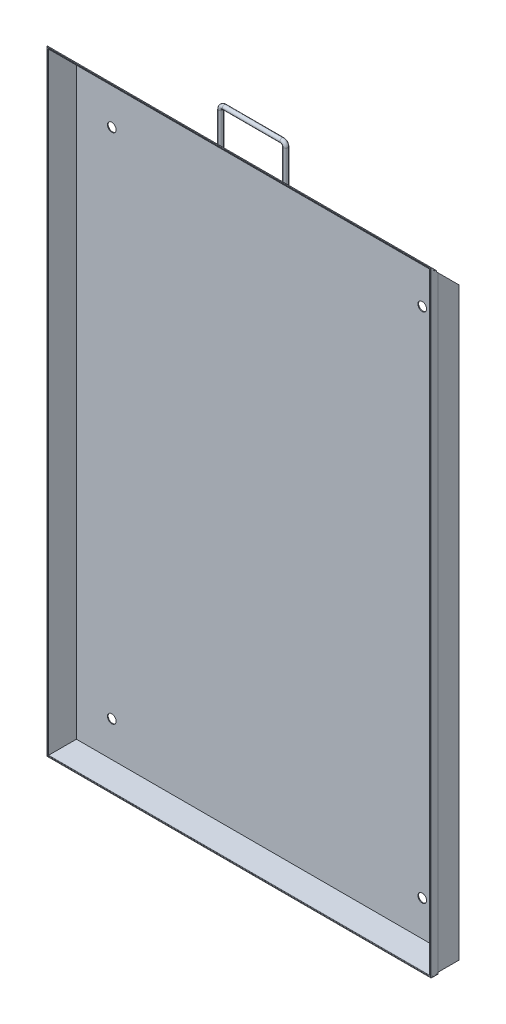
from build123d import *
from build123d.topology import SkipClean

# Parameters (mm, degrees)
BOSS_EXTRUDE1_DEPTH  = 265
BOSS_EXTRUDE2_DEPTH  = 1
BOSS_EXTRUDE3_DEPTH  = 1
SKETCH5_R            = 6
CUT_EXTRUDE1_DEPTH   = 1
BOSS_EXTRUDE5_REACH  = 913.299
SKETCH6_R            = 3
SKETCH10_R           = 3
BOSS_EXTRUDE7_DEPTH  = 1
BOSS_EXTRUDE8_DEPTH  = 1
SKETCH16_W           = 532.2
SKETCH16_H           = 10
BOSS_EXTRUDE9_DEPTH  = 1
SKETCH18_W           = 532.2
SKETCH18_H           = 10
BOSS_EXTRUDE10_DEPTH = 1
SKETCH19_W           = 532.2
SKETCH19_H           = 851.170710678
SKETCH19_W_2         = 528
SKETCH19_H_2         = 847.585786438
BOSS_EXTRUDE11_DEPTH = 1
CUT_EXTRUDE2_DEPTH   = 532.2
FILLET1_R            = 0.5
FILLET2_START        = -267
FILLET2_DEPTH        = 534


with BuildPart() as part:
    # Sketch2 → Boss-Extrude1 (new, symmetric)
    with BuildSketch(Plane(origin=(0, 0, 0), x_dir=(0, 0, -1), z_dir=(1, 0, 0))):
        Polygon((0, 20), (-40, 20), (-40, 21), (-1, 21), (-1, 829.585786438), (-40, 868.585786438), (-40, 870), (0, 830), align=None)
    extrude(amount=BOSS_EXTRUDE1_DEPTH, both=True)

    # Sketch3 → Boss-Extrude2 (add)
    with BuildSketch(Plane(origin=(265, 0, 0), x_dir=(0, 0, -1), z_dir=(1, 0, 0))):
        Polygon((-40, 870), (0, 830), (0, 20), (-40, 20), align=None)
    extrude(amount=-BOSS_EXTRUDE2_DEPTH)

    # Sketch4 → Boss-Extrude3 (add)
    with BuildSketch(Plane.ZY.offset(265)):
        Polygon((40, 870), (0, 830), (0, 20), (40, 20), align=None)
    extrude(amount=-BOSS_EXTRUDE3_DEPTH)

    # Sketch5 → Cut-Extrude1 (cut)
    with BuildSketch(Plane.XY.offset(1)):
        with Locations((215, 779.585786438)):
            Circle(SKETCH5_R)
        with Locations((215, 70)):
            Circle(SKETCH5_R)
        with Locations((-215, 779.585786438)):
            Circle(SKETCH5_R)
        with Locations((-215, 70)):
            Circle(SKETCH5_R)
    extrude(amount=-CUT_EXTRUDE1_DEPTH, mode=Mode.SUBTRACT)

    # Boss-Extrude5: up to this plane
    boss_extrude5_end = Plane(origin=(265, 870, 40), z_dir=(0, -0.7071067811865444, 0.7071067811865508))
    # Sketch6 → Boss-Extrude5 (add, up to the surface)
    with BuildSketch(Plane(origin=(0, 891, 0), x_dir=(1, 0, 0), z_dir=(0, 1, 0)), mode=Mode.PRIVATE) as boss_extrude5_sk1:
        with Locations(Location((-45, -20, 0), (0, 0, 270))):
            Circle(SKETCH6_R)
    boss_extrude5_tool1 = split(extrude(boss_extrude5_sk1.sketch, amount=-BOSS_EXTRUDE5_REACH, mode=Mode.PRIVATE), bisect_by=boss_extrude5_end, keep=Keep.BOTH, mode=Mode.PRIVATE)
    add(boss_extrude5_tool1.solids().sort_by_distance((-45, 891, 20))[0])
    # Sketch6 → Boss-Extrude5 (add, up to the surface)
    with BuildSketch(Plane(origin=(0, 891, 0), x_dir=(1, 0, 0), z_dir=(0, 1, 0)), mode=Mode.PRIVATE) as boss_extrude5_sk2:
        with Locations(Location((45, -20, 0), (0, 0, 270))):
            Circle(SKETCH6_R)
    boss_extrude5_tool2 = split(extrude(boss_extrude5_sk2.sketch, amount=-BOSS_EXTRUDE5_REACH, mode=Mode.PRIVATE), bisect_by=boss_extrude5_end, keep=Keep.BOTH, mode=Mode.PRIVATE)
    add(boss_extrude5_tool2.solids().sort_by_distance((45, 891, 20))[0])

    # Sweep1: sweep along a path in Sketch9
    with SkipClean():  # the faces are left unmerged after this step: merging them gives an invalid solid
        with BuildLine(Plane(origin=(0, 0, 20), x_dir=(-1, 0, 0), z_dir=(0, 0, -1))) as sweep1_path:
            Line((-45, 891), (-45, 896))
            ThreePointArc((-45, 896), (-43.535533906, 899.535533906), (-40, 901))
            Line((-40, 901), (40, 901))
            ThreePointArc((40, 901), (43.535533906, 899.535533906), (45, 896))
            Line((45, 896), (45, 891))
        # Sketch10 → Sweep1 (sweep)
        with BuildSketch(Plane(origin=(0, 891, 0), x_dir=(1, 0, 0), z_dir=(0, 1, 0))):
            with Locations((45, -20)):
                Circle(SKETCH10_R)
        sweep(path=sweep1_path.line)



with BuildPart() as body_2:
    # Sketch13 → Boss-Extrude7 (new body)
    with BuildSketch(Plane(origin=(265.1, 0, 0), x_dir=(0, 0, -1), z_dir=(1, 0, 0))):
        Polygon((-30, 20), (-30, 860), (-40, 870), (-40, 20), align=None)
    extrude(amount=BOSS_EXTRUDE7_DEPTH)


with BuildPart() as body_3:
    # Sketch15 → Boss-Extrude8 (new body)
    with BuildSketch(Plane.ZY.offset(265.1)):
        Polygon((30, 20), (30, 860), (40, 870), (40, 20), align=None)
    extrude(amount=BOSS_EXTRUDE8_DEPTH)


with BuildPart() as body_4:
    # Sketch16 → Boss-Extrude9 (new body)
    with BuildSketch(Plane(origin=(0, 19.9, 0), x_dir=(-1, 0, 0), z_dir=(0, -1, 0))):
        with Locations((0, -35)):
            Rectangle(SKETCH16_W, SKETCH16_H)
    extrude(amount=BOSS_EXTRUDE9_DEPTH)


with BuildPart() as body_5:
    # Sketch18 → Boss-Extrude10 (new body)
    with BuildSketch(Plane(origin=(0, 415.070710678, -415.070710678), x_dir=(-1, 0, 0), z_dir=(0, 0.7071067811865445, -0.7071067811865507))):
        with Locations((0, 638.46717088)):
            Rectangle(SKETCH18_W, SKETCH18_H)
    extrude(amount=BOSS_EXTRUDE10_DEPTH)


with BuildPart() as part_1:
    with SkipClean():  # the faces are left unmerged after this step: merging them gives an invalid solid
        add(part.part)

        add(body_2.part)  # Boss-Extrude11 merges body 2

        add(body_3.part)  # Boss-Extrude11 merges body 3

        add(body_4.part)  # Boss-Extrude11 merges body 4

        add(body_5.part)  # Boss-Extrude11 merges body 5
        # Sketch19 → Boss-Extrude11 (add)
        with BuildSketch(Plane.XY.offset(40)):
            with Locations((0, 444.485355339)):
                Rectangle(SKETCH19_W, SKETCH19_H)
            with Locations((0, 444.792893219)):
                Rectangle(SKETCH19_W_2, SKETCH19_H_2, mode=Mode.SUBTRACT)
        extrude(amount=-BOSS_EXTRUDE11_DEPTH)

    # Sketch20 → Cut-Extrude2 (cut)
    with SkipClean():  # the faces are left unmerged after this step: merging them gives an invalid solid
        with BuildSketch(Plane(origin=(266.1, 0, 0), x_dir=(0, 0, -1), z_dir=(1, 0, 0))):
            Polygon((-39.929289322, 870.070710678), (-40, 870), (-40, 870.070710678), align=None)
        extrude(amount=-CUT_EXTRUDE2_DEPTH, mode=Mode.SUBTRACT)

    # Fillet1
    # the kernel refuses this fillet: 0.5 mm, written as the material it takes off along each edge
    with BuildSketch(Plane(origin=(267.35, 18.9, 40), x_dir=(0, 1, 0), z_dir=(-1, 0, 0))) as fillet1_piece_1:
        with BuildLine():
            CenterArc((FILLET1_R, FILLET1_R), FILLET1_R, 180, 90)
            Line((0, FILLET1_R), (0, 0))
            Line((0, 0), (FILLET1_R, 0))
        make_face()
    extrude(amount=534.7, mode=Mode.SUBTRACT)
    with BuildSketch(Plane(origin=(266.1, 871.25, 40), x_dir=(0, 0, -1), z_dir=(0, -1, 0))) as fillet1_piece_2:
        with BuildLine():
            CenterArc((FILLET1_R, -FILLET1_R), FILLET1_R, 90, 90)
            Line((0, -FILLET1_R), (0, 0))
            Line((0, 0), (FILLET1_R, 0))
        make_face()
    extrude(amount=851.25, mode=Mode.SUBTRACT)
    with BuildSketch(Plane(origin=(-266.1, 871.25, 40), x_dir=(0, 0, -1), z_dir=(0, -1, 0))) as fillet1_piece_3:
        with BuildLine():
            CenterArc((FILLET1_R, FILLET1_R), FILLET1_R, 180, 90)
            Line((0, FILLET1_R), (0, 0))
            Line((0, 0), (FILLET1_R, 0))
        make_face()
    extrude(amount=851.25, mode=Mode.SUBTRACT)
    with BuildSketch(Plane(origin=(265, 870, 40), x_dir=(0, 0.7071067811869935, -0.7071067811861015), z_dir=(-1, 0, 0))) as fillet1_piece_4:
        with BuildLine():
            CenterArc((FILLET1_R * 0.414213562373, FILLET1_R), FILLET1_R, 225, 45)
            Line((-FILLET1_R * 0.292893218814, FILLET1_R * 0.292893218813), (0, 0))
            Line((0, 0), (FILLET1_R * 0.414213562373, 0))
        make_face()
    extrude(amount=530, mode=Mode.SUBTRACT)
    with BuildSketch(Plane(origin=(264, 21, 40), x_dir=(0, -1, 0), z_dir=(-1, 0, 0))) as fillet1_piece_5:
        with BuildLine():
            CenterArc((FILLET1_R, -FILLET1_R), FILLET1_R, 90, 90)
            Line((0, -FILLET1_R), (0, 0))
            Line((0, 0), (FILLET1_R, 0))
        make_face()
    extrude(amount=528, mode=Mode.SUBTRACT)
    with BuildSketch(Plane(origin=(264, 868.585786438, 40), x_dir=(0, -0.7071067811865132, -0.7071067811865818), z_dir=(-1, 0, 0))) as fillet1_piece_6:
        with BuildLine():
            CenterArc((FILLET1_R * 0.414213562373, -FILLET1_R), FILLET1_R, 90, 45)
            Line((-FILLET1_R * 0.292893218813, -FILLET1_R * 0.292893218813), (0, 0))
            Line((0, 0), (FILLET1_R * 0.414213562373, 0))
        make_face()
    extrude(amount=528, mode=Mode.SUBTRACT)
    with BuildSketch(Plane(origin=(264, 21, 40), x_dir=(1, 0, 0), z_dir=(0, 1, 0))) as fillet1_piece_7_section:
        with BuildLine():
            CenterArc((FILLET1_R, FILLET1_R), FILLET1_R, 180, 90)
            Line((0, FILLET1_R), (0, 0))
            Line((0, 0), (FILLET1_R, 0))
        make_face()
    fillet1_piece_7 = extrude(amount=848.835786438, mode=Mode.PRIVATE)
    fillet1_piece_7 = split(fillet1_piece_7, bisect_by=Plane(origin=(264, 444.792893219, -383.792893219), z_dir=(0, -0.7071067811865426, 0.7071067811865525)), keep=Keep.TOP, mode=Mode.PRIVATE)
    add(fillet1_piece_7, mode=Mode.SUBTRACT)
    with BuildSketch(Plane(origin=(-264, 21, 40), x_dir=(-1, 0, 0), z_dir=(0, 1, 0))) as fillet1_piece_8_section:
        with BuildLine():
            CenterArc((FILLET1_R, -FILLET1_R), FILLET1_R, 90, 90)
            Line((0, -FILLET1_R), (0, 0))
            Line((0, 0), (FILLET1_R, 0))
        make_face()
    fillet1_piece_8 = extrude(amount=848.835786438, mode=Mode.PRIVATE)
    fillet1_piece_8 = split(fillet1_piece_8, bisect_by=Plane(origin=(-264, 444.792893219, -383.792893219), z_dir=(0, -0.7071067811865426, 0.7071067811865525)), keep=Keep.TOP, mode=Mode.PRIVATE)
    add(fillet1_piece_8, mode=Mode.SUBTRACT)
    with BuildSketch(Plane(origin=(265.1, 870, 40), x_dir=(0, -1, 0), z_dir=(-1, 0, 0)), Plane(origin=(-265, 870, 40), x_dir=(0, -1, 0), z_dir=(-1, 0, 0))) as fillet1_piece_9:
        with BuildLine():
            CenterArc((FILLET1_R * 0.414213562373, -FILLET1_R), FILLET1_R, 90, 45)
            Line((-FILLET1_R * 0.292893218814, -FILLET1_R * 0.292893218814), (0, 0))
            Line((0, 0), (FILLET1_R * 0.414213562373, 0))
        make_face()
    extrude(amount=0.1, mode=Mode.SUBTRACT)
    with BuildSketch(Plane(origin=(-265.1, 870, 40), x_dir=(0, 0.7071067811869935, -0.7071067811861015), z_dir=(-1, 0, 0))) as fillet1_piece_10:
        with BuildLine():
            CenterArc((FILLET1_R * 0.414213562373, FILLET1_R), FILLET1_R, 225, 45)
            Line((-FILLET1_R * 0.292893218814, FILLET1_R * 0.292893218813), (0, 0))
            Line((0, 0), (FILLET1_R * 0.414213562373, 0))
        make_face()
    extrude(amount=1.517766953, mode=Mode.SUBTRACT)
    with BuildSketch(Plane(origin=(265.1, 870, 40), x_dir=(0, 0.7071067811869935, -0.7071067811861015), z_dir=(1, 0, 0))) as fillet1_piece_11:
        with BuildLine():
            CenterArc((FILLET1_R * 0.414213562373, -FILLET1_R), FILLET1_R, 90, 45)
            Line((-FILLET1_R * 0.292893218814, -FILLET1_R * 0.292893218813), (0, 0))
            Line((0, 0), (FILLET1_R * 0.414213562373, 0))
        make_face()
    extrude(amount=1.517766953, mode=Mode.SUBTRACT)
    with BuildSketch(Plane(origin=(-266.1, 20, 40), x_dir=(0, 0, -1), z_dir=(0, -1, 0)), Plane(origin=(266.1, 19.9, 40), x_dir=(0, 0, -1), z_dir=(0, 1, 0))) as fillet1_piece_12:
        with BuildLine():
            CenterArc((FILLET1_R, FILLET1_R), FILLET1_R, 180, 90)
            Line((0, FILLET1_R), (0, 0))
            Line((0, 0), (FILLET1_R, 0))
        make_face()
    extrude(amount=0.1, mode=Mode.SUBTRACT)
    with BuildSketch(Plane(origin=(-266.1, 19.9, 40), x_dir=(0, 0, -1), z_dir=(0, -1, 0))) as fillet1_piece_13:
        with BuildLine():
            CenterArc((FILLET1_R, FILLET1_R), FILLET1_R, 180, 90)
            Line((0, FILLET1_R), (0, 0))
            Line((0, 0), (FILLET1_R, 0))
        make_face()
    extrude(amount=2.25, mode=Mode.SUBTRACT)
    with BuildSketch(Plane(origin=(266.1, 19.9, 40), x_dir=(0, 0, -1), z_dir=(0, -1, 0))) as fillet1_piece_14:
        with BuildLine():
            CenterArc((FILLET1_R, -FILLET1_R), FILLET1_R, 90, 90)
            Line((0, -FILLET1_R), (0, 0))
            Line((0, 0), (FILLET1_R, 0))
        make_face()
    extrude(amount=2.25, mode=Mode.SUBTRACT)
    with BuildSketch(Plane(origin=(265.25, 21, 40), x_dir=(0, -1, 0), z_dir=(-1, 0, 0))) as fillet1_piece_15a_section:
        with BuildLine():
            CenterArc((FILLET1_R, -FILLET1_R), FILLET1_R, 90, 90)
            Line((0, -FILLET1_R), (0, 0))
            Line((0, 0), (FILLET1_R, 0))
        make_face()
    fillet1_piece_15a = extrude(amount=529.25, mode=Mode.PRIVATE)
    fillet1_piece_15a = split(fillet1_piece_15a, bisect_by=Plane(origin=(264, 21, 40), z_dir=(1, 0, 0)), keep=Keep.TOP, mode=Mode.PRIVATE)
    with BuildSketch(Plane(origin=(264, 19.75, 40), x_dir=(1, 0, 0), z_dir=(0, 1, 0))) as fillet1_piece_15b_section:
        with BuildLine():
            CenterArc((FILLET1_R, FILLET1_R), FILLET1_R, 180, 90)
            Line((0, FILLET1_R), (0, 0))
            Line((0, 0), (FILLET1_R, 0))
        make_face()
    fillet1_piece_15b = extrude(amount=850.085786438, mode=Mode.PRIVATE)
    fillet1_piece_15b = split(fillet1_piece_15b, bisect_by=Plane(origin=(264, 21, 40), z_dir=(0, -1, 0)), keep=Keep.TOP, mode=Mode.PRIVATE)
    fillet1_piece_15 = fillet1_piece_15a & fillet1_piece_15b
    add(fillet1_piece_15, mode=Mode.SUBTRACT)
    with BuildSketch(Plane(origin=(-264, 19.75, 40), x_dir=(-1, 0, 0), z_dir=(0, 1, 0))) as fillet1_piece_16a_section:
        with BuildLine():
            CenterArc((FILLET1_R, -FILLET1_R), FILLET1_R, 90, 90)
            Line((0, -FILLET1_R), (0, 0))
            Line((0, 0), (FILLET1_R, 0))
        make_face()
    fillet1_piece_16a = extrude(amount=850.085786438, mode=Mode.PRIVATE)
    fillet1_piece_16a = split(fillet1_piece_16a, bisect_by=Plane(origin=(-264, 21, 40), z_dir=(0, -1, 0)), keep=Keep.TOP, mode=Mode.PRIVATE)
    with BuildSketch(Plane(origin=(264, 21, 40), x_dir=(0, -1, 0), z_dir=(-1, 0, 0))) as fillet1_piece_16b_section:
        with BuildLine():
            CenterArc((FILLET1_R, -FILLET1_R), FILLET1_R, 90, 90)
            Line((0, -FILLET1_R), (0, 0))
            Line((0, 0), (FILLET1_R, 0))
        make_face()
    fillet1_piece_16b = extrude(amount=529.25, mode=Mode.PRIVATE)
    fillet1_piece_16b = split(fillet1_piece_16b, bisect_by=Plane(origin=(-264, 21, 40), z_dir=(-1, 0, 0)), keep=Keep.TOP, mode=Mode.PRIVATE)
    fillet1_piece_16 = fillet1_piece_16a & fillet1_piece_16b
    add(fillet1_piece_16, mode=Mode.SUBTRACT)
    with BuildSketch(Plane(origin=(264.517766953, 868.585786438, 40), x_dir=(0, -0.7071067811865132, -0.7071067811865818), z_dir=(-1, 0, 0))) as fillet1_piece_17a_section:
        with BuildLine():
            CenterArc((FILLET1_R * 0.414213562373, -FILLET1_R), FILLET1_R, 90, 45)
            Line((-FILLET1_R * 0.292893218813, -FILLET1_R * 0.292893218813), (0, 0))
            Line((0, 0), (FILLET1_R * 0.414213562373, 0))
        make_face()
    fillet1_piece_17a = extrude(amount=528.517766953, mode=Mode.PRIVATE)
    fillet1_piece_17a = split(fillet1_piece_17a, bisect_by=Plane(origin=(264, 868.585786438, 40), z_dir=(1, 0, 0)), keep=Keep.TOP, mode=Mode.PRIVATE)
    with BuildSketch(Plane(origin=(264, 21, 40), x_dir=(1, 0, 0), z_dir=(0, 1, 0))) as fillet1_piece_17b_section:
        with BuildLine():
            CenterArc((FILLET1_R, FILLET1_R), FILLET1_R, 180, 90)
            Line((0, FILLET1_R), (0, 0))
            Line((0, 0), (FILLET1_R, 0))
        make_face()
    fillet1_piece_17b = extrude(amount=848.835786438, mode=Mode.PRIVATE)
    fillet1_piece_17b = split(fillet1_piece_17b, bisect_by=Plane(origin=(264, 444.792893219, -383.792893219), z_dir=(0, 0.7071067811865426, -0.7071067811865525)), keep=Keep.TOP, mode=Mode.PRIVATE)
    fillet1_piece_17 = fillet1_piece_17a & fillet1_piece_17b
    add(fillet1_piece_17, mode=Mode.SUBTRACT)
    with BuildSketch(Plane(origin=(264, 868.585786438, 40), x_dir=(0, -0.7071067811865132, -0.7071067811865818), z_dir=(-1, 0, 0))) as fillet1_piece_18a_section:
        with BuildLine():
            CenterArc((FILLET1_R * 0.414213562373, -FILLET1_R), FILLET1_R, 90, 45)
            Line((-FILLET1_R * 0.292893218813, -FILLET1_R * 0.292893218813), (0, 0))
            Line((0, 0), (FILLET1_R * 0.414213562373, 0))
        make_face()
    fillet1_piece_18a = extrude(amount=528.517766953, mode=Mode.PRIVATE)
    fillet1_piece_18a = split(fillet1_piece_18a, bisect_by=Plane(origin=(-264, 868.585786438, 40), z_dir=(-1, 0, 0)), keep=Keep.TOP, mode=Mode.PRIVATE)
    with BuildSketch(Plane(origin=(-264, 21, 40), x_dir=(-1, 0, 0), z_dir=(0, 1, 0))) as fillet1_piece_18b_section:
        with BuildLine():
            CenterArc((FILLET1_R, -FILLET1_R), FILLET1_R, 90, 90)
            Line((0, -FILLET1_R), (0, 0))
            Line((0, 0), (FILLET1_R, 0))
        make_face()
    fillet1_piece_18b = extrude(amount=848.835786438, mode=Mode.PRIVATE)
    fillet1_piece_18b = split(fillet1_piece_18b, bisect_by=Plane(origin=(-264, 444.792893219, -383.792893219), z_dir=(0, 0.7071067811865426, -0.7071067811865525)), keep=Keep.TOP, mode=Mode.PRIVATE)
    fillet1_piece_18 = fillet1_piece_18a & fillet1_piece_18b
    add(fillet1_piece_18, mode=Mode.SUBTRACT)

    # Fillet2: read off the stored shape, not the designer's step
    # Fillet2 outline → Fillet2 (cut)
    with SkipClean():  # the faces are left unmerged after this step: merging them gives an invalid solid
        with BuildSketch(Plane.YZ.offset(FILLET2_START)):
            with BuildLine():
                Line((870.777817459, 39.222182541), (870.424264069, 39.575735931))
                ThreePointArc((870.424264069, 39.575735931), (870.570710678, 39.22218254), (870.424264069, 38.86862915))
                Line((870.424264069, 38.86862915), (870.777817459, 39.222182541))
            make_face()
        extrude(amount=FILLET2_DEPTH, mode=Mode.SUBTRACT)
    add(part_1.part.scale(1), mode=Mode.REPLACE)  # the faces are merged on a copy


solid = part_1.part
